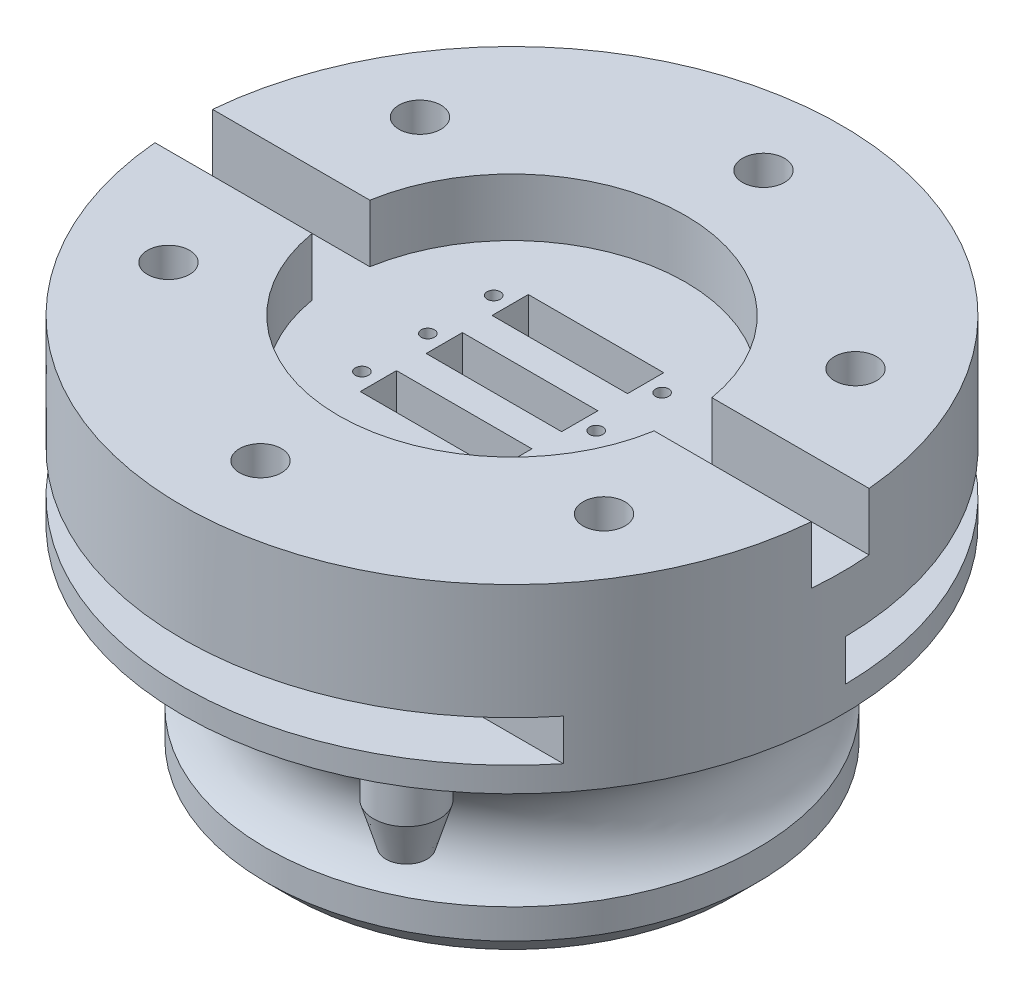
from build123d import *

# Parameters (mm, degrees)
SKETCH1_R                       = 29.8
SKETCH1_R_2                     = 20.2
BOSS_EXTRUDE1_DEPTH             = 25.7
SKETCH3_R                       = 40
BOSS_EXTRUDE2_DEPTH             = 15
SKETCH4_R                       = 4
BOSS_EXTRUDE3_DEPTH             = 5
SKETCH6_R                       = 2.5
CUT_EXTRUDE1_START              = -12
CUT_EXTRUDE1_DEPTH              = 5
CUT_EXTRUDE6_DEPTH              = 3.2
SKETCH15_W                      = 16.44
SKETCH15_H                      = 4.4
CUT_EXTRUDE7_DEPTH              = 63.132841557
SKETCH16_R                      = 0.8
CUT_EXTRUDE8_DEPTH              = 64.523302811
CUT_EXTRUDE15_START             = 40
SKETCH25_R                      = 3.2
CUT_EXTRUDE15_DEPTH             = 3.5
SKETCH20_R                      = 40
SKETCH20_R_2                    = 21.05
BOSS_EXTRUDE4_DEPTH             = 7
CUT_EXTRUDE17_REACH             = 75.995
SKETCH28_W                      = 7
SKETCH28_H                      = 7
CUT_EXTRUDE17_DIRECTION_2_REACH = 75.995
SKETCH29_R                      = 2.55
BASEPLATE_MOUNTING_HOLES_DEPTH  = 4.825


with BuildPart() as part:
    # Sketch1 → Boss-Extrude1 (new body)
    with BuildSketch(Plane(origin=(0, 0, 0), x_dir=(1, 0, 0), z_dir=(0, 1, 0))):
        with Locations(Location((0, 0, 0), (0, 0, 90))):
            Circle(SKETCH1_R)
        with Locations(Location((0, 0, 0), (0, 0, 90))):
            Circle(SKETCH1_R_2, mode=Mode.SUBTRACT)
    extrude(amount=BOSS_EXTRUDE1_DEPTH)

    # Sketch2 → Cut-Revolve1 (revolve, cut)
    with BuildSketch(Plane.XY, mode=Mode.PRIVATE) as cut_revolve1_sk:
        with BuildLine():
            Line((29.8, 12.7), (29.8, 18.799180273))
            ThreePointArc((29.8, 18.799180273), (27.590586132, 16.098529094), (26.8, 12.7))
            Line((26.8, 12.7), (29.8, 12.7))
        make_face()
        with BuildLine():
            Line((29.8, 6.600819727), (29.8, 12.7))
            Line((29.8, 12.7), (26.8, 12.7))
            ThreePointArc((26.8, 12.7), (27.590586132, 9.301470906), (29.8, 6.600819727))
        make_face()
        Polygon((29.8, 3), (26.8, 0), (29.8, 0), align=None)
    revolve(cut_revolve1_sk.sketch.rotate(Axis((0, 25.7, 0), (0, -1, 0)), 270), axis=Axis((0, 25.7, 0), (0, -1, 0)), mode=Mode.SUBTRACT)

    # Sketch3 → Boss-Extrude2 (add)
    with BuildSketch(Plane(origin=(0, 25.7, 0), x_dir=(1, 0, 0), z_dir=(0, 1, 0))):
        with Locations(Location((0, 0, 0), (0, 0, 270))):
            Circle(SKETCH3_R)
    extrude(amount=BOSS_EXTRUDE2_DEPTH)

    # Sketch4 → Boss-Extrude3 (add)
    with BuildSketch(Plane(origin=(0, 25.7, 0), x_dir=(-1, 0, 0), z_dir=(0, -1, 0))):
        with Locations(Location((-17.5, -30.310889132, 0), (0, 0, 270))):
            Circle(SKETCH4_R)
        with Locations(Location((32.889241728, -11.970705016, 0), (0, 0, 270))):
            Circle(SKETCH4_R)
        with Locations(Location((-6.077686218, 34.468271355, 0), (0, 0, 270))):
            Circle(SKETCH4_R)
    extrude(amount=BOSS_EXTRUDE3_DEPTH)

    # Sketch6 → section 1 of loft1
    with BuildSketch(Plane(origin=(0, 15.7, 0), x_dir=(-1, 0, 0), z_dir=(0, -1, 0)), mode=Mode.PRIVATE) as loft1_s1:
        with Locations((32.889241728, -11.970705016)):
            Circle(SKETCH6_R)
    # loft from a face of the part (loft1)
    loft([part.faces().sort_by_distance((-32.889241728, 20.7, 11.970705016))[0], loft1_s1.sketch])

    # Boundary1: read off the stored shape, not the designer's step
    # Boundary1 outline → Boundary1 (revolve)
    with BuildSketch(Plane(origin=(17.5, 0, 30.310889132), x_dir=(1, 0, 0), z_dir=(0, 0, 1))):
        Polygon((0, 20.7), (0, 15.7), (2.5, 15.7), (4, 20.7), align=None)
    revolve(axis=Axis((17.5, 0, 30.310889132), (0, 1, 0)))

    # Boundary2: read off the stored shape, not the designer's step
    # Boundary2: loft between two sections, ruled curve by curve
    boundary2_from = [
        Edge.make_bspline([(9.922742778, 20.7, -33.365756026), (9.778423859, 20.7, -32.862439299), (9.289775651, 20.7, -31.913155977), (8.067478825, 20.7, -30.878607721), (6.542374051, 20.7, -30.390384874), (4.946413374, 20.7, -30.522974824), (3.522746317, 20.7, -31.256212676), (2.488002725, 20.7, -32.478460941), (1.999820352, 20.7, -34.003603594), (2.132382571, 20.7, -35.599531113), (2.865650923, 20.7, -37.023214684), (4.087837179, 20.7, -38.057933438), (5.613033755, 20.7, -38.546155237), (7.208931106, 20.7, -38.413575903), (8.632657493, 20.7, -37.680313497), (9.667322676, 20.7, -36.45811299), (10.155689167, 20.7, -34.933056337), (10.067061697, 20.7, -33.869072752), (9.922742778, 20.7, -33.365756026)], [0, 0, 0, 0, 0.0625, 0.125, 0.1875, 0.25, 0.3125, 0.375, 0.4375, 0.5, 0.5625, 0.625, 0.6875, 0.75, 0.8125, 0.875, 0.9375, 1, 1, 1, 1], 3),
    ]
    boundary2_to = [
        Edge.make_bspline([(8.313438837, 15.7, -33.349606871), (8.167005998, 15.7, -33.056947538), (7.757868808, 15.7, -32.529805617), (6.88811309, 15.7, -32.034506513), (5.895137902, 15.7, -31.909602819), (4.929849468, 15.7, -32.174234081), (4.139348951, 15.7, -32.788112293), (3.643935799, 15.7, -33.657748526), (3.519005287, 15.7, -34.650828768), (3.783658552, 15.7, -35.616093907), (4.397524642, 15.7, -36.406629525), (5.26722668, 15.7, -36.902042852), (6.260254151, 15.7, -37.026934051), (7.225507947, 15.7, -36.762316146), (8.016039922, 15.7, -36.14841822), (8.511411727, 15.7, -35.27881634), (8.63646584, 15.7, -34.285761617), (8.459871676, 15.7, -33.642266205), (8.313438837, 15.7, -33.349606871)], [0, 0, 0, 0, 0.0625, 0.125, 0.1875, 0.25, 0.3125, 0.375, 0.4375, 0.5, 0.5625, 0.625, 0.6875, 0.75, 0.8125, 0.875, 0.9375, 1, 1, 1, 1], 3),
    ]
    boundary2 = Solid(Shell([*[Face.make_surface_from_curves(boundary2_from[k], boundary2_to[k]) for k in range(1)], Face(Wire(boundary2_from)), Face(Wire(boundary2_to))]))
    add(boundary2)

    # Sketch7 → Cut-Extrude1 (cut)
    with BuildSketch(Plane(origin=(0, 40.7, 0), x_dir=(1, 0, 0), z_dir=(0, 1, 0)).offset(CUT_EXTRUDE1_START)):
        with BuildLine():
            ThreePointArc((31.224989992, 25), (0, 40), (-31.224989992, 25))
            Line((-31.224989992, 25), (0, 25))
            Line((0, 25), (31.224989992, 25))
        make_face()
        with BuildLine():
            Line((-5.8e-08, -25), (-31.224989992, -25))
            ThreePointArc((-31.224989992, -25), (0, -40), (31.224989992, -25))
            Line((31.224989992, -25), (-5.8e-08, -25))
        make_face()
        with BuildLine():
            Line((-19.515618745, -15.625), (-31.224989992, -25))
            Line((-31.224989992, -25), (-5.8e-08, -25))
            ThreePointArc((-5.8e-08, -25), (-10.825317574, -22.534695459), (-19.515618745, -15.625))
        make_face()
        with BuildLine():
            Line((-24.998227986, -0.297653397), (-39.997164778, -0.476245435))
            ThreePointArc((-39.997164778, -0.476245435), (-37.663011922, -13.472102025), (-31.224989992, -25))
            Line((-31.224989992, -25), (-19.515618745, -15.625))
            ThreePointArc((-19.515618745, -15.625), (-23.539382451, -8.420063766), (-24.998227986, -0.297653397))
        make_face()
        with BuildLine():
            ThreePointArc((39.997164778, 0.476245435), (37.663011922, 13.472102025), (31.224989992, 25))
            Line((31.224989992, 25), (19.515618745, 15.625))
            ThreePointArc((19.515618745, 15.625), (23.539382451, 8.420063766), (24.998227986, 0.297653397))
            Line((24.998227986, 0.297653397), (39.997164778, 0.476245435))
        make_face()
        with BuildLine():
            Line((31.224989992, 25), (0, 25))
            ThreePointArc((0, 25), (10.825317547, 22.534695472), (19.515618745, 15.625))
            Line((19.515618745, 15.625), (31.224989992, 25))
        make_face()
    extrude(amount=CUT_EXTRUDE1_DEPTH, mode=Mode.SUBTRACT)

    # Sketch14 → Cut-Extrude6 (cut)
    with BuildSketch(Plane(origin=(0, 25.7, 0), x_dir=(-1, 0, 0), z_dir=(0, -1, 0))):
        with BuildLine():
            Line((10.22, -2.2), (-10.22, -2.2))
            ThreePointArc((-10.22, -2.2), (-12.42, 0), (-10.22, 2.2))
            Line((-10.22, 2.2), (10.22, 2.2))
            ThreePointArc((10.22, 2.2), (12.42, 0), (10.22, -2.2))
        make_face()
        with BuildLine():
            Line((10.22, 10.2), (-10.22, 10.2))
            ThreePointArc((-10.22, 10.2), (-12.42, 8), (-10.22, 5.8))
            Line((-10.22, 5.8), (10.22, 5.8))
            ThreePointArc((10.22, 5.8), (12.42, 8), (10.22, 10.2))
        make_face()
        with BuildLine():
            Line((10.22, -5.8), (-10.22, -5.8))
            ThreePointArc((-10.22, -5.8), (-12.42, -8), (-10.22, -10.2))
            Line((-10.22, -10.2), (10.22, -10.2))
            ThreePointArc((10.22, -10.2), (12.42, -8), (10.22, -5.8))
        make_face()
    extrude(amount=-CUT_EXTRUDE6_DEPTH, mode=Mode.SUBTRACT)

    # Sketch15 → Cut-Extrude7 (cut, through all)
    with BuildSketch(Plane(origin=(0, 25.7, 0), x_dir=(-1, 0, 0), z_dir=(0, -1, 0))):
        Rectangle(SKETCH15_W, SKETCH15_H)
        with Locations((0, -8)):
            Rectangle(SKETCH15_W, SKETCH15_H)
        with Locations((0, 8)):
            Rectangle(SKETCH15_W, SKETCH15_H)
    extrude(amount=-CUT_EXTRUDE7_DEPTH, mode=Mode.SUBTRACT)

    # Sketch16 → Cut-Extrude8 (cut, through all)
    with BuildSketch(Plane(origin=(0, 28.9, 0), x_dir=(-1, 0, 0), z_dir=(0, -1, 0))):
        with Locations(Location((-10.22, -8, 0), (0, 0, 90))):
            Circle(SKETCH16_R)
        with Locations(Location((-10.22, 0, 0), (0, 0, 90))):
            Circle(SKETCH16_R)
        with Locations(Location((-10.22, 8, 0), (0, 0, 90))):
            Circle(SKETCH16_R)
        with Locations(Location((10.22, -8, 0), (0, 0, 90))):
            Circle(SKETCH16_R)
        with Locations(Location((10.22, 0, 0), (0, 0, 90))):
            Circle(SKETCH16_R)
        with Locations(Location((10.22, 8, 0), (0, 0, 90))):
            Circle(SKETCH16_R)
    extrude(amount=-CUT_EXTRUDE8_DEPTH, mode=Mode.SUBTRACT)

    # Sketch25 → Cut-Extrude15 (cut)
    with BuildSketch(Plane(origin=(0, 0, 0), x_dir=(0, -1, 0), z_dir=(-0.9455185755993166, 0, -0.32556815445715737)).offset(CUT_EXTRUDE15_START)):
        with Locations(Location((-31.2, 0, 0), (0, 0, 90))):
            Circle(SKETCH25_R)
    extrude(amount=-CUT_EXTRUDE15_DEPTH, mode=Mode.SUBTRACT)

    # Sketch20 → Boss-Extrude4 (add)
    with BuildSketch(Plane(origin=(0, 40.7, 0), x_dir=(1, 0, 0), z_dir=(0, 1, 0))):
        with Locations(Location((0, 0, 0), (0, 0, 270))):
            Circle(SKETCH20_R)
        with Locations(Location((0, 0, 0), (0, 0, 270))):
            Circle(SKETCH20_R_2, mode=Mode.SUBTRACT)
    extrude(amount=BOSS_EXTRUDE4_DEPTH)

    # Sketch28 → Cut-Extrude17 (cut, up to next)
    with BuildSketch(Plane(origin=(0, 0, 0), x_dir=(0, 0, -1), z_dir=(1, 0, 0)), mode=Mode.PRIVATE) as cut_extrude17_sk1:
        with Locations((0, 44.2)):
            Rectangle(SKETCH28_W, SKETCH28_H)
    cut_extrude17_tool1 = extrude(cut_extrude17_sk1.sketch, amount=-CUT_EXTRUDE17_REACH, mode=Mode.PRIVATE) & part.part
    add(cut_extrude17_tool1.solids().sort_by_distance((0, 44.2, 0))[0], mode=Mode.SUBTRACT)

    # Sketch28 → Cut-Extrude17 direction 2 (cut, up to next)
    with BuildSketch(Plane(origin=(0, 0, 0), x_dir=(0, 0, -1), z_dir=(1, 0, 0)), mode=Mode.PRIVATE) as cut_extrude17_direction_2_sk1:
        with Locations((0, 44.2)):
            Rectangle(SKETCH28_W, SKETCH28_H)
    cut_extrude17_direction_2_tool1 = extrude(cut_extrude17_direction_2_sk1.sketch, amount=CUT_EXTRUDE17_DIRECTION_2_REACH, mode=Mode.PRIVATE) & part.part
    add(cut_extrude17_direction_2_tool1.solids().sort_by_distance((0, 44.2, 0))[0], mode=Mode.SUBTRACT)

    # Sketch29 → baseplate mounting holes (cut)
    with BuildSketch(Plane(origin=(0, 47.7, 0), x_dir=(1, 0, 0), z_dir=(0, 1, 0))):
        with Locations(Location((0, 30.525, 0), (0, 0, 270))):
            Circle(SKETCH29_R)
        with Locations(Location((26.435425451, 15.2625, 0), (0, 0, 270))):
            Circle(SKETCH29_R)
        with Locations(Location((26.435425451, -15.2625, 0), (0, 0, 270))):
            Circle(SKETCH29_R)
        with Locations(Location((0, -30.525, 0), (0, 0, 270))):
            Circle(SKETCH29_R)
        with Locations(Location((-26.435425451, -15.2625, 0), (0, 0, 270))):
            Circle(SKETCH29_R)
        with Locations(Location((-26.435425451, 15.2625, 0), (0, 0, 270))):
            Circle(SKETCH29_R)
    extrude(amount=-BASEPLATE_MOUNTING_HOLES_DEPTH, mode=Mode.SUBTRACT)


solid = part.part
